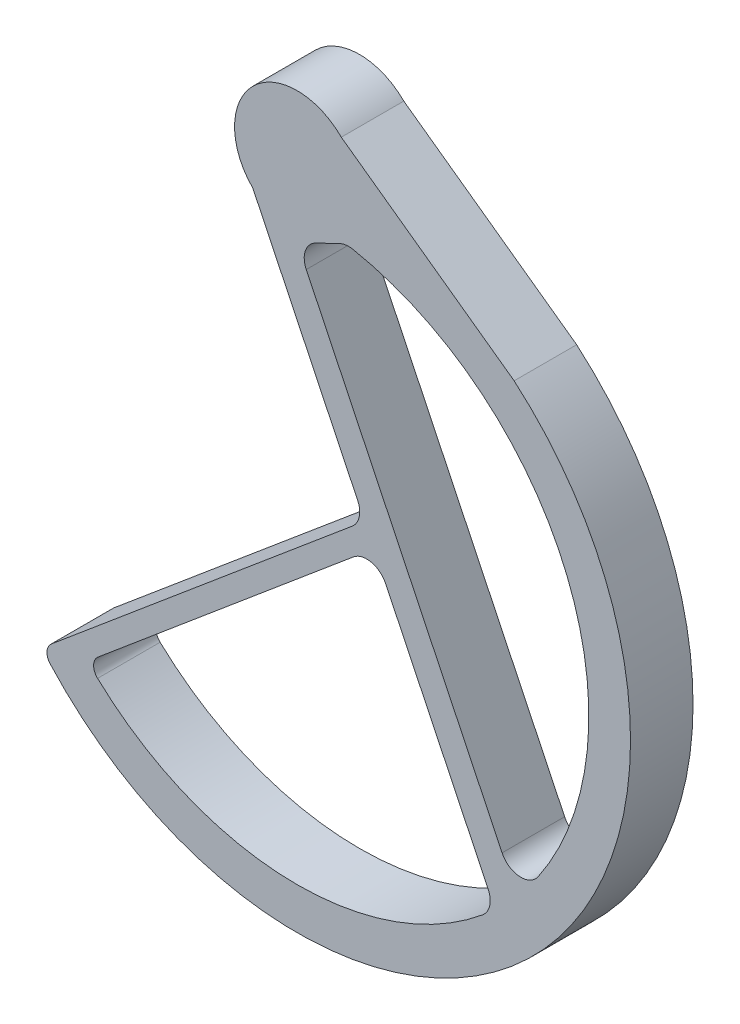
from build123d import *

# Parameters (mm, degrees)
EXTRUDE_1_DEPTH     = 15
CUT_EXTRUDE_START   = -15
CUT_EXTRUDE_1_DEPTH = 15
SKETCH_8_R          = 10.1
CUT_EXTRUDE_3_DEPTH = 2


with BuildPart() as part:
    # ｽｹｯﾁ4 → ﾎﾞｽ - 押し出し1 (new body)
    with BuildSketch(Plane.XY):
        with BuildLine():
            Line((13.244185189, -68.886809092), (-53.623111018, -124.995132678))
            Line((-53.623111018, -124.995132678), (-58.940636287, -129.45706617))
            ThreePointArc((-58.940636287, -129.45706617), (-60.005384698, -131.552012131), (-59.233530865, -133.771635843))
            ThreePointArc((-59.233530865, -133.771635843), (-58.595754044, -134.465930709), (-57.949839695, -135.15266158))
            ThreePointArc((-57.949839695, -135.15266158), (58.01545948, -135.083631519), (52.076178918, -19.270504783))
            Line((52.076178918, -19.270504783), (10.606601718, 10.606601718))
            ThreePointArc((10.606601718, 10.606601718), (-10.606601718, 10.606601718), (-10.606601718, -10.606601718))
            Line((-10.606601718, -10.606601718), (14.536280154, -62.889638219))
            ThreePointArc((14.536280154, -62.889638219), (14.918089499, -66.109676181), (13.244185189, -68.886809092))
        make_face()
        with BuildLine():
            ThreePointArc((13.511229465, -75.151532228), (17.77869109, -74.092739753), (21.232400696, -76.813798404))
            Line((21.232400696, -76.813798404), (45.844843506, -127.993820346))
            ThreePointArc((45.844843506, -127.993820346), (46.221944165, -131.235480845), (44.518718993, -134.019289696))
            ThreePointArc((44.518718993, -134.019289696), (-2.231208213, -149.964431749), (-47.870174388, -131.072951785))
            ThreePointArc((-47.870174388, -131.072951785), (-48.817477846, -128.802229421), (-47.747678417, -126.586582094))
            Line((-47.747678417, -126.586582094), (13.511229465, -75.151532228))
        make_face(mode=Mode.SUBTRACT)
    extrude(amount=EXTRUDE_1_DEPTH)

    # ｽｹｯﾁ6 → ｶｯﾄ - 押し出し1 (cut)
    with BuildSketch(Plane.XY.offset(15).offset(CUT_EXTRUDE_START)):
        with BuildLine():
            Line((49.189589797, -118.797265215), (2.201751786, -21.089020696))
            ThreePointArc((2.201751786, -21.089020696), (1.989274209, -17.268089629), (4.540836142, -14.416039025))
            Line((4.540836142, -14.416039025), (6.483415605, -13.48185369))
            Line((6.483415605, -13.48185369), (10.219658847, -11.685096486))
            ThreePointArc((10.219658847, -11.685096486), (11.747077013, -11.232198087), (13.339423466, -11.282754846))
            ThreePointArc((13.339423466, -11.282754846), (64.738421392, -53.37413296), (57.826055334, -119.448033215))
            ThreePointArc((57.826055334, -119.448033215), (53.319931874, -121.616182211), (49.189589797, -118.797265215))
        make_face()
    extrude(amount=CUT_EXTRUDE_1_DEPTH, mode=Mode.SUBTRACT)

    # ｽｹｯﾁ8 → ｶｯﾄ - 押し出し3 (cut)
    with BuildSketch(Plane(origin=(0, 0, 0), x_dir=(-1, 0, 0), z_dir=(0, 0, -1))):
        Circle(SKETCH_8_R)
    extrude(amount=-CUT_EXTRUDE_3_DEPTH, mode=Mode.SUBTRACT)


solid = part.part
